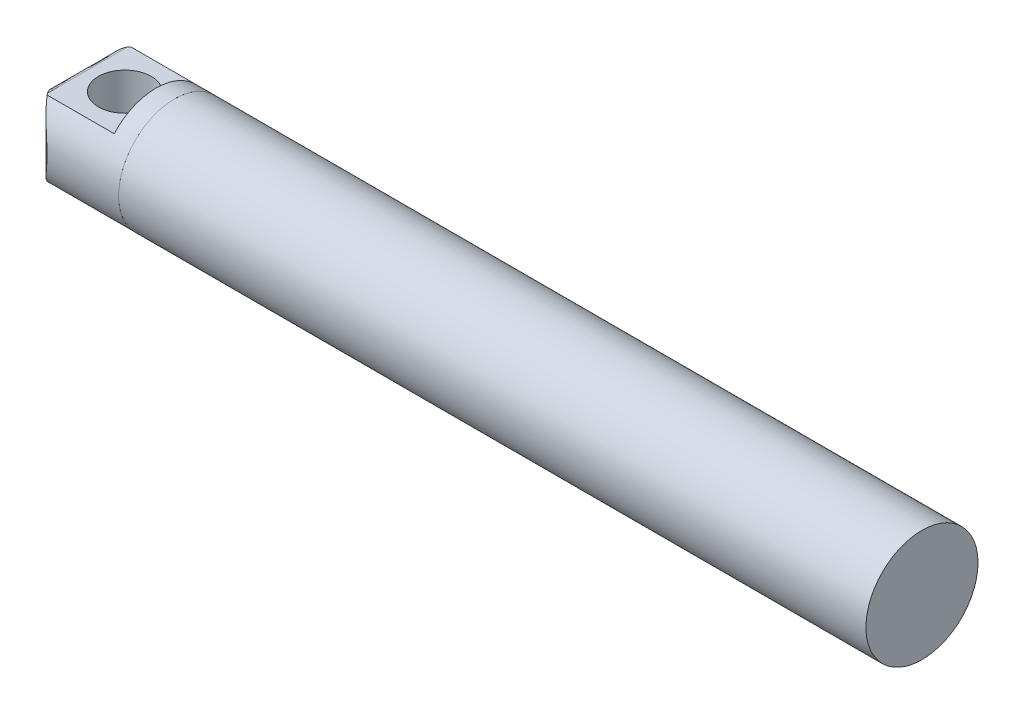
from build123d import *

# Parameters (mm, degrees)
SKETCH2_R               = 4.5
BOSS_EXTRUDE1_DEPTH     = 60
SKETCH3_R               = 4.5
BOSS_EXTRUDE2_DEPTH     = 8
CUT_EXTRUDE1_DEPTH      = 6.5
SKETCH5_R               = 2.125
CUT_EXTRUDE2_DEPTH      = 61.634148794
FILLET2_SIZE            = 3
FILLET2_SIZE_2          = 1
FILLET3_SIZE            = 3
FILLET3_SIZE_2          = 1
CUT_EXTRUDE5_DEPTH      = 61.634148814
CUT_EXTRUDE5_DEPTH_BACK = 61.634148814


with BuildPart() as part:
    # Sketch2 → Boss-Extrude1 (new body)
    with BuildSketch(Plane(origin=(0, 0, 0), x_dir=(0, 0, -1), z_dir=(1, 0, 0))):
        Circle(SKETCH2_R)
    extrude(amount=BOSS_EXTRUDE1_DEPTH)


with BuildPart() as body_2:
    # Sketch3 → Boss-Extrude2 (new body)
    with BuildSketch(Plane.ZY):
        Circle(SKETCH3_R)
    extrude(amount=BOSS_EXTRUDE2_DEPTH)

    # Sketch4 → Cut-Extrude1 (cut)
    with BuildSketch(Plane.ZY.offset(8)):
        with BuildLine():
            ThreePointArc((3.354101966, 3), (0, 4.5), (-3.354101966, 3))
            Line((-3.354101966, 3), (3.354101966, 3))
        make_face()
        with BuildLine():
            Line((3.354101966, -3), (-3.354101966, -3))
            ThreePointArc((-3.354101966, -3), (0, -4.5), (3.354101966, -3))
        make_face()
    extrude(amount=-CUT_EXTRUDE1_DEPTH, mode=Mode.SUBTRACT)

    # Sketch5 → Cut-Extrude2 (cut, through all)
    with BuildSketch(Plane.XZ.offset(3)):
        with Locations(Location((-4, 0, 0), (0, 0, 270))):
            Circle(SKETCH5_R)
    extrude(amount=-CUT_EXTRUDE2_DEPTH, mode=Mode.SUBTRACT)

    # Fillet2
    # an asymmetric fillet: 3, 1 mm, written as the material it takes off along each edge
    with BuildSketch(Plane(origin=(-8, -3, 10.854101966), x_dir=(0, 1, 0), z_dir=(0, 0, -1))) as fillet2_piece_1:
        with BuildLine():
            Bezier((FILLET2_SIZE, 0), (0, 0), (0, FILLET2_SIZE_2), weights=[1, 0.707106781, 1])
            Line((0, FILLET2_SIZE_2), (0, 0))
            Line((0, 0), (FILLET2_SIZE, 0))
        make_face()
    extrude(amount=21.708203932, mode=Mode.SUBTRACT)

    # Fillet3
    # an asymmetric fillet: 3, 1 mm, written as the material it takes off along each edge
    with BuildSketch(Plane(origin=(-8, 3, -10.854101966), x_dir=(0, -1, 0), z_dir=(0, 0, 1))) as fillet3_piece_1:
        with BuildLine():
            Bezier((FILLET3_SIZE, 0), (0, 0), (0, FILLET3_SIZE_2), weights=[1, 0.707106781, 1])
            Line((0, FILLET3_SIZE_2), (0, 0))
            Line((0, 0), (FILLET3_SIZE, 0))
        make_face()
    extrude(amount=21.708203932, mode=Mode.SUBTRACT)

    # Sketch8 → Cut-Extrude5 (cut, two sides: drawn at the far end of the back side and taken through both)
    with BuildSketch(Plane.XZ.offset(3).offset(-CUT_EXTRUDE5_DEPTH_BACK)):
        with BuildLine():
            Line((-7, -3.354101966), (-6.890597967, -3.354101966))
            ThreePointArc((-6.890597967, -3.354101966), (-6.945935342, -3.278288441), (-7, -3.201562119))
            Line((-7, -3.201562119), (-7, -3.354101966))
        make_face()
        with BuildLine():
            Line((-8, -4.5), (-5.75, -4.5))
            ThreePointArc((-5.75, -4.5), (-6.361684668, -3.968245249), (-6.890597967, -3.354101966))
            Line((-6.890597967, -3.354101966), (-7, -3.354101966))
            Line((-7, -3.354101966), (-7, -3.201562119))
            ThreePointArc((-7, -3.201562119), (-7.744182899, -1.677050983), (-8, 0))
            Line((-8, 0), (-8, -4.5))
        make_face()
        with BuildLine():
            Line((-7, 3.354101966), (-7, 3.201562119))
            ThreePointArc((-7, 3.201562119), (-6.945935342, 3.278288441), (-6.890597967, 3.354101966))
            Line((-6.890597967, 3.354101966), (-7, 3.354101966))
        make_face()
        with BuildLine():
            Line((-8, 4.5), (-8, 0))
            ThreePointArc((-8, 0), (-7.744182899, 1.677050983), (-7, 3.201562119))
            Line((-7, 3.201562119), (-7, 3.354101966))
            Line((-7, 3.354101966), (-6.890597967, 3.354101966))
            ThreePointArc((-6.890597967, 3.354101966), (-6.361684668, 3.968245249), (-5.75, 4.5))
            Line((-5.75, 4.5), (-8, 4.5))
        make_face()
    extrude(amount=CUT_EXTRUDE5_DEPTH + CUT_EXTRUDE5_DEPTH_BACK, mode=Mode.SUBTRACT)


solid = Compound([part.part, body_2.part])
